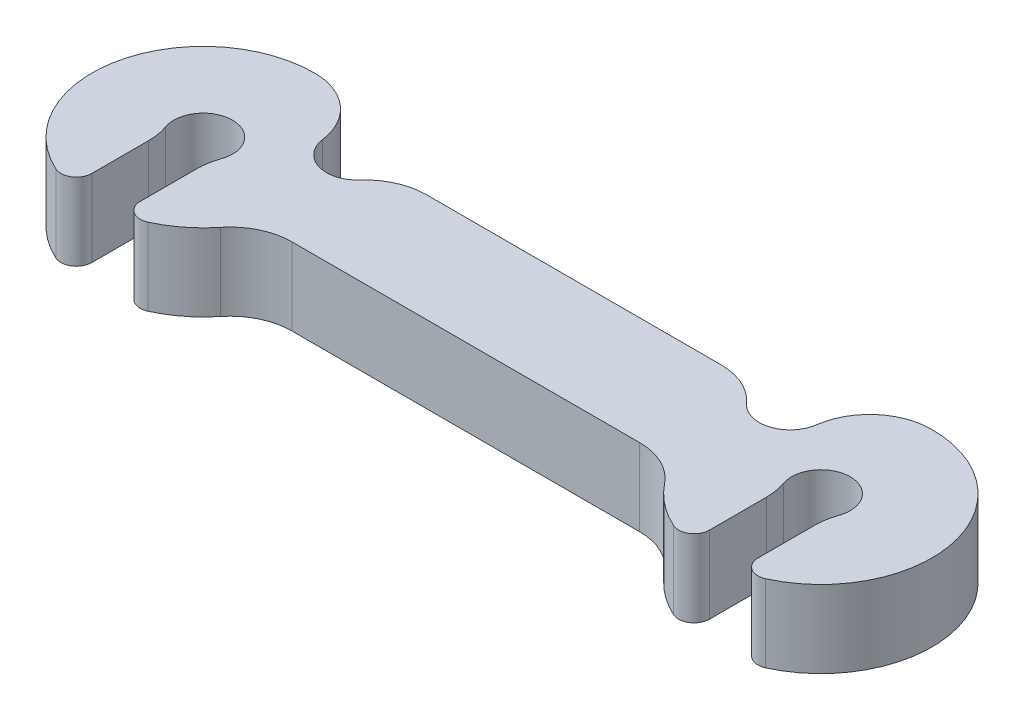
from build123d import *

# Parameters (mm, degrees)
SKIZZE1_R                       = 0.952
AUFSATZ_LINEAR_AUSTRAGEN1_DEPTH = 1.25
SKIZZE2_R                       = 1
SCHNITT_LINEAR_AUSTRAGEN1_DEPTH = 15.288806808
VERRUNDUNG1_R                   = 2
VERRUNDUNG2_R                   = 0.5


with BuildPart() as part:
    # Skizze1 → Aufsatz-Linear austragen1 (new, symmetric)
    with BuildSketch(Plane(origin=(0, 0, 0), x_dir=(1, 0, 0), z_dir=(0, 1, 0))):
        with BuildLine():
            Line((-6.727386366, -1.5), (0, -1.5))
            Line((0, -1.5), (0, 2))
            Line((0, 2), (-7.006674091, 2))
            ThreePointArc((-7.006674091, 2), (-13.588592982, -0.286357134), (-6.727386366, -1.5))
        make_face()
        with Locations((-10, 0)):
            Circle(SKIZZE1_R, mode=Mode.SUBTRACT)
    extrude(amount=AUFSATZ_LINEAR_AUSTRAGEN1_DEPTH, both=True)

    # Skizze2 → Schnitt-Linear austragen1 (cut, through all)
    with BuildSketch(Plane(origin=(0, 1.25, 0), x_dir=(1, 0, 0), z_dir=(0, 1, 0))):
        with Locations((-7.006674091, 2)):
            Circle(SKIZZE2_R)
        with BuildLine():
            Line((-9.216, 0), (-9.216, -3.6))
            ThreePointArc((-9.216, -3.6), (-10, -4.384), (-10.784, -3.6))
            Line((-10.784, -3.6), (-10.784, 0))
            ThreePointArc((-10.784, 0), (-10, 0.784), (-9.216, 0))
        make_face()
    extrude(amount=-SCHNITT_LINEAR_AUSTRAGEN1_DEPTH, mode=Mode.SUBTRACT)

    # Verrundung1
    verrundung1_edges = [part.edges().sort_by_distance(p)[0] for p in [
        (-10.784, 0, 0.540044443),
        (-9.216, 0, 0.540044443),
        (-6.006674091, 0, -2),
        (-7.672328438, 0, -2.746260202),
        (-6.727386366, 0, 1.5),
    ]]
    fillet(verrundung1_edges, radius=VERRUNDUNG1_R)

    # Verrundung2
    verrundung2_edges = [part.edges().sort_by_distance(p)[0] for p in [
        (-9.216, 0, 3.513594171),
        (-10.784, 0, 3.513594171),
    ]]
    fillet(verrundung2_edges, radius=VERRUNDUNG2_R)

    # Spiegeln1: part across plane


with BuildPart() as part_1:
    add(part.part)
    add(part.part.mirror(Plane(origin=(0, 1.25, -2), x_dir=(0, 0, 1), z_dir=(-1, 0, 0))))


solid = part_1.part
